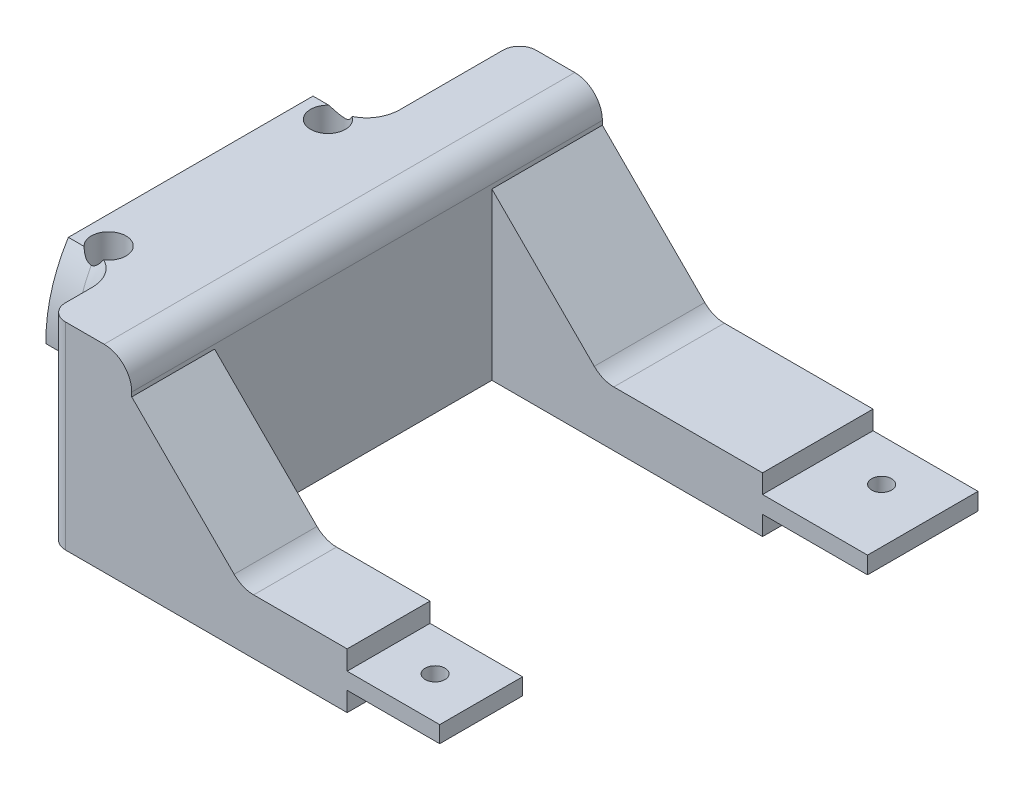
from build123d import *

# Parameters (mm, degrees)
ESBO_O1_W                         = 16.75
ESBO_O1_H                         = 3
RESSALTO_EXTRUS_O1_DEPTH          = 10
ESBO_O2_W                         = 39
ESBO_O2_H                         = 10
RESSALTO_EXTRUS_O2_DEPTH          = 20
ESBO_O3_W                         = 68
ESBO_O3_H                         = 20
RESSALTO_EXTRUS_O3_DEPTH          = 10
CORTE_EXTRUS_O1_REACH             = 107.71
ESBO_O4_W                         = 19
ESBO_O4_H                         = 3.5
ESBO_O4_H_2                       = 3.4
ESBO_O5_W                         = 85.2
ESBO_O5_H                         = 25.76
RESSALTO_EXTRUS_O4_DEPTH          = 15
RESSALTO_EXTRUS_O5_DEPTH          = 10
CORTE_EXTRUS_O2_REACH             = 108.224
ESBO_O7_R                         = 1.8
ESBO_O8_R                         = 3.15
CORTE_EXTRUS_O3_DEPTH             = 5
CHANFRO1_SIZE                     = 20
FILETE1_R                         = 5
FILETE4_R                         = 3
FILETE5_R                         = 5
FILETE6_R                         = 5
CORTE_EXTRUS_O4_REACH             = 110.394
ESBO_O9_R                         = 1.8
CORTE_EXTRUS_O4_DIRECTION_2_DEPTH = 5
ESBO_O10_W                        = 55.75
ESBO_O10_H                        = 5
CORTE_EXTRUS_O5_DEPTH             = 111.326598128


with BuildPart() as part:
    # Esboço1 → Ressalto-extrusão1 (new, symmetric)
    with BuildSketch(Plane.XY):
        Rectangle(ESBO_O1_W, ESBO_O1_H)
    extrude(amount=RESSALTO_EXTRUS_O1_DEPTH, both=True)

    # Esboço2 → Ressalto-extrusão2 (add, through all)
    with BuildSketch(Plane.XY.offset(10)):
        with Locations((-27.875, 0)):
            Rectangle(ESBO_O2_W, ESBO_O2_H)
    extrude(amount=-RESSALTO_EXTRUS_O2_DEPTH)

    # Esboço3 → Ressalto-extrusão3 (add, through all)
    with BuildSketch(Plane(origin=(0, 5, 0), x_dir=(1, 0, 0), z_dir=(0, 1, 0))):
        Polygon((-62.375, -10), (-47.375, -10), (-47.375, 10), (-47.375, 55.2), (-47.375, 75.2), (-62.375, 75.2), align=None)
        with Locations((-13.375, 65.2)):
            Rectangle(ESBO_O3_W, ESBO_O3_H)
    extrude(amount=-RESSALTO_EXTRUS_O3_DEPTH)

    # Esboço4 → Corte-extrusão1 (cut, up to next)
    with BuildSketch(Plane(origin=(0, 0, -75.2), x_dir=(-1, 0, 0), z_dir=(0, 0, -1)), mode=Mode.PRIVATE) as corte_extrus_o1_sk1:
        with Locations((-11.125, -3.25)):
            Rectangle(ESBO_O4_W, ESBO_O4_H)
    corte_extrus_o1_tool1 = extrude(corte_extrus_o1_sk1.sketch, amount=-CORTE_EXTRUS_O1_REACH, mode=Mode.PRIVATE) & part.part
    # Esboço4 → Corte-extrusão1 (cut, up to next)
    with BuildSketch(Plane(origin=(0, 0, -75.2), x_dir=(-1, 0, 0), z_dir=(0, 0, -1)), mode=Mode.PRIVATE) as corte_extrus_o1_sk2:
        with Locations((-11.125, 3.3)):
            Rectangle(ESBO_O4_W, ESBO_O4_H_2)
    corte_extrus_o1_tool2 = extrude(corte_extrus_o1_sk2.sketch, amount=-CORTE_EXTRUS_O1_REACH, mode=Mode.PRIVATE) & part.part
    add(corte_extrus_o1_tool1.solids().sort_by_distance((11.125, -3.25, -75.2))[0], mode=Mode.SUBTRACT)
    add(corte_extrus_o1_tool2.solids().sort_by_distance((11.125, 3.3, -75.2))[0], mode=Mode.SUBTRACT)

    # Esboço5 → Ressalto-extrusão4 (add)
    with BuildSketch(Plane.ZY.offset(62.375)):
        with Locations((-32.6, 17.88)):
            Rectangle(ESBO_O5_W, ESBO_O5_H)
    extrude(amount=-RESSALTO_EXTRUS_O4_DEPTH)

    # Esboço6 → Ressalto-extrusão5 (add)
    with BuildSketch(Plane.ZY.offset(62.375)):
        with BuildLine():
            Line((-36.669998569, 16.76), (-38.519998569, 16.76))
            Line((-38.519998569, 16.76), (-40.519998569, 14.76))
            Line((-40.519998569, 14.76), (-50.519998569, 14.76))
            Line((-50.519998569, 14.76), (-51.86172779, 16.101729221))
            ThreePointArc((-51.86172779, 16.101729221), (-50.925638362, 23.730843469), (-47.815878547, 30.76))
            Line((-47.815878547, 30.76), (-3.524118591, 30.76))
            ThreePointArc((-3.524118591, 30.76), (-0.414358777, 23.730843469), (0.521730651, 16.101729221))
            Line((0.521730651, 16.101729221), (-0.819998569, 14.76))
            Line((-0.819998569, 14.76), (-10.819998569, 14.76))
            Line((-10.819998569, 14.76), (-12.819998569, 16.76))
            Line((-12.819998569, 16.76), (-14.669998569, 16.76))
            ThreePointArc((-14.669998569, 16.76), (-25.669998569, 27.76), (-36.669998569, 16.76))
        make_face()
    extrude(amount=RESSALTO_EXTRUS_O5_DEPTH)

    # Esboço7 → Corte-extrusão2 (cut, up to next)
    with BuildSketch(Plane.XZ.offset(-14.76), mode=Mode.PRIVATE) as corte_extrus_o2_sk1:
        with Locations(Location((-67.375, -5.819998569, 0), (0, 0, 270))):
            Circle(ESBO_O7_R)
    corte_extrus_o2_tool1 = extrude(corte_extrus_o2_sk1.sketch, amount=-CORTE_EXTRUS_O2_REACH, mode=Mode.PRIVATE) & part.part
    # Esboço7 → Corte-extrusão2 (cut, up to next)
    with BuildSketch(Plane.XZ.offset(-14.76), mode=Mode.PRIVATE) as corte_extrus_o2_sk2:
        with Locations(Location((-67.375, -45.519998569, 0), (0, 0, 270))):
            Circle(ESBO_O7_R)
    corte_extrus_o2_tool2 = extrude(corte_extrus_o2_sk2.sketch, amount=-CORTE_EXTRUS_O2_REACH, mode=Mode.PRIVATE) & part.part
    add(corte_extrus_o2_tool1.solids().sort_by_distance((-67.375, 14.76, -5.819999))[0], mode=Mode.SUBTRACT)
    add(corte_extrus_o2_tool2.solids().sort_by_distance((-67.375, 14.76, -45.519999))[0], mode=Mode.SUBTRACT)

    # Esboço8 → Corte-extrusão3 (cut)
    with BuildSketch(Plane(origin=(0, 30.76, 0), x_dir=(1, 0, 0), z_dir=(0, 1, 0))):
        with Locations(Location((-67.375, 45.519998569, 0), (0, 0, 180))):
            Circle(ESBO_O8_R)
        with Locations(Location((-67.375, 5.819998569, 0), (0, 0, 180))):
            Circle(ESBO_O8_R)
    extrude(amount=-CORTE_EXTRUS_O3_DEPTH, mode=Mode.SUBTRACT)

    # Chanfro1
    chanfro1_edges = [part.edges().sort_by_distance(p)[0] for p in [
        (-47.375, 5, -65.2),
        (-47.375, 5, 0),
    ]]
    chamfer(chanfro1_edges, length=CHANFRO1_SIZE)

    # Filete1
    # the kernel refuses this fillet: 5 mm, written as the material it adds along each edge
    with BuildSketch(Plane(origin=(-62.375, 16.76, -25.669998569), x_dir=(0, -0.4814020816411878, -0.8764998778046299), z_dir=(0, -0.8764998778046299, 0.4814020816411878))) as filete1_piece_1_section:
        with BuildLine():
            CenterArc((26.2 + FILETE1_R, -FILETE1_R), FILETE1_R, 90, 90)
            Line((26.2, -FILETE1_R), (26.2, 0))
            Line((26.2, 0), (26.2 + FILETE1_R, 0))
        make_face()
    filete1_piece_1 = revolve(axis=Axis((-62.375, 16.76, -25.669998569), (1, 0, 0)), revolution_arc=88.414248189, mode=Mode.PRIVATE)
    filete1_piece_1 = split(filete1_piece_1, bisect_by=Plane(origin=(-63.543022515, 30.76, -51.592589171), z_dir=(0, -1, 0)), keep=Keep.TOP, mode=Mode.PRIVATE)
    filete1_piece_1 = split(filete1_piece_1, bisect_by=Plane(origin=(-63.543022515, 19.962032762, -55.722031332), z_dir=(0, 0.7071067811865495, 0.7071067811865457)), keep=Keep.TOP, mode=Mode.PRIVATE)
    filete1_piece_1 = filete1_piece_1 - Plane(origin=(-67.375, 24.091474922, -45.519998569), x_dir=(-1, 0, 0), z_dir=(0, 1, 0)) * Cylinder(3.15, 125, mode=Mode.PRIVATE)
    add(filete1_piece_1)
    with BuildSketch(Plane(origin=(-62.375, 16.76, -25.669998569), x_dir=(0, 0.8628423353119256, 0.5054731490331239), z_dir=(0, 0.5054731490331239, -0.8628423353119256))) as filete1_piece_2_section:
        with BuildLine():
            CenterArc((26.2 + FILETE1_R, -FILETE1_R), FILETE1_R, 90, 90)
            Line((26.2, -FILETE1_R), (26.2, 0))
            Line((26.2, 0), (26.2 + FILETE1_R, 0))
        make_face()
    filete1_piece_2 = revolve(axis=Axis((-62.375, 16.76, -25.669998569), (1, 0, 0)), revolution_arc=88.414248189, mode=Mode.PRIVATE)
    filete1_piece_2 = split(filete1_piece_2, bisect_by=Plane(origin=(-63.543022328, 19.962032891, 4.382034321), z_dir=(0, 0.7071067811865496, -0.7071067811865455)), keep=Keep.TOP, mode=Mode.PRIVATE)
    filete1_piece_2 = split(filete1_piece_2, bisect_by=Plane(origin=(-63.543022328, 30.76, 0.252591971), z_dir=(0, -1, 0)), keep=Keep.TOP, mode=Mode.PRIVATE)
    filete1_piece_2 = filete1_piece_2 - Plane(origin=(-67.375, 24.091475241, -5.819998569), x_dir=(-1, 0, 0), z_dir=(0, 1, 0)) * Cylinder(3.15, 125, mode=Mode.PRIVATE)
    add(filete1_piece_2)

    # Filete4
    filete4_edges = [part.edges().sort_by_distance(p)[0] for p in [
        (-62.375, 12.88, 10),
        (-62.375, 12.88, -75.2),
    ]]
    fillet(filete4_edges, radius=FILETE4_R)

    # Filete5
    filete5_edges = [part.edges().sort_by_distance(p)[0] for p in [
        (-47.375, 30.76, -32.6),
    ]]
    fillet(filete5_edges, radius=FILETE5_R)

    # Filete6
    filete6_edges = [part.edges().sort_by_distance(p)[0] for p in [
        (-27.375, 5, -65.2),
        (-27.375, 5, 0),
    ]]
    fillet(filete6_edges, radius=FILETE6_R)

    # Esboço9 → Corte-extrusão4 (cut, up to next)
    with BuildSketch(Plane(origin=(0, 1.5, 0), x_dir=(1, 0, 0), z_dir=(0, 1, 0)), mode=Mode.PRIVATE) as corte_extrus_o4_sk1:
        with Locations((0, -2.46)):
            Circle(ESBO_O9_R)
    corte_extrus_o4_tool1 = extrude(corte_extrus_o4_sk1.sketch, amount=-CORTE_EXTRUS_O4_REACH, mode=Mode.PRIVATE) & part.part
    # Esboço9 → Corte-extrusão4 (cut, up to next)
    with BuildSketch(Plane(origin=(0, 1.5, 0), x_dir=(1, 0, 0), z_dir=(0, 1, 0)), mode=Mode.PRIVATE) as corte_extrus_o4_sk2:
        with Locations((10.815, 67.565)):
            Circle(ESBO_O9_R)
    corte_extrus_o4_tool2 = extrude(corte_extrus_o4_sk2.sketch, amount=-CORTE_EXTRUS_O4_REACH, mode=Mode.PRIVATE) & part.part
    add(corte_extrus_o4_tool1.solids().sort_by_distance((0, 1.5, 2.46))[0], mode=Mode.SUBTRACT)
    add(corte_extrus_o4_tool2.solids().sort_by_distance((10.815, 1.5, -67.565))[0], mode=Mode.SUBTRACT)

    # Esboço9 → Corte-extrusão4 direction 2 (cut)
    with BuildSketch(Plane(origin=(0, 1.5, 0), x_dir=(1, 0, 0), z_dir=(0, 1, 0))):
        with Locations((0, -2.46)):
            Circle(ESBO_O9_R)
        with Locations((10.815, 67.565)):
            Circle(ESBO_O9_R)
    extrude(amount=CORTE_EXTRUS_O4_DIRECTION_2_DEPTH, mode=Mode.SUBTRACT)

    # Esboço10 → Corte-extrusão5 (cut, through all)
    with BuildSketch(Plane(origin=(0, 30.76, 0), x_dir=(1, 0, 0), z_dir=(0, 1, 0))):
        with Locations((-19.5, 7.5)):
            Rectangle(ESBO_O10_W, ESBO_O10_H)
    extrude(amount=-CORTE_EXTRUS_O5_DEPTH, mode=Mode.SUBTRACT)


solid = part.part
